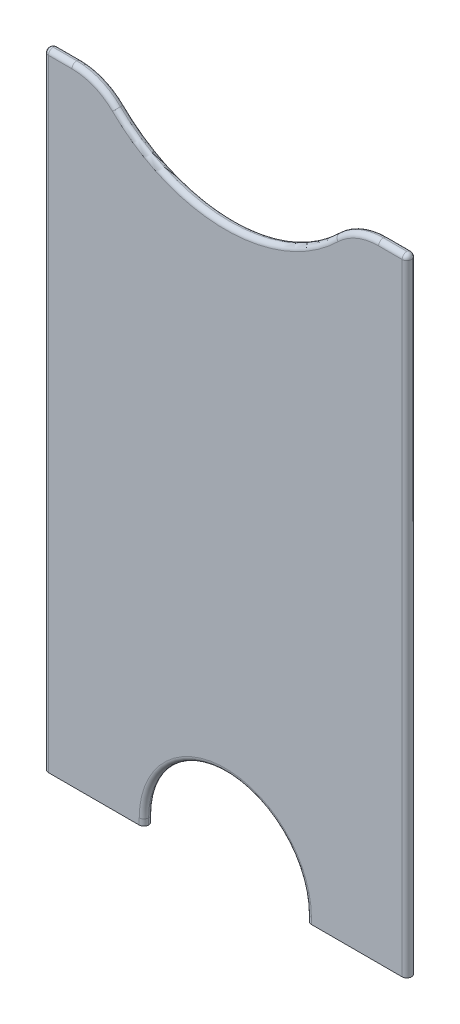
from build123d import *

# Parameters (mm, degrees)
BOSS_EXTRUDE1_DEPTH     = 100
CUT_EXTRUDE1_DEPTH      = 105.130927202
CUT_EXTRUDE1_DEPTH_BACK = 105.130927202
CUT_EXTRUDE2_DEPTH      = 10
FILLET6_R               = 10
FILLET7_R               = 10
FILLET13_R              = 0.75
FILLET14_R              = 0.75


with BuildPart() as part:
    # Sketch1 → Boss-Extrude1 (new body)
    with BuildSketch(Plane(origin=(0, 0, 0), x_dir=(1, 0, 0), z_dir=(0, 1, 0))):
        with BuildLine():
            Line((-28.25, 0), (28.25, 0))
            ThreePointArc((28.25, 0), (29, 0.75), (28.25, 1.5))
            Line((28.25, 1.5), (-28.25, 1.5))
            ThreePointArc((-28.25, 1.5), (-29, 0.75), (-28.25, 0))
        make_face()
    extrude(amount=BOSS_EXTRUDE1_DEPTH)

    # Sketch2 → Cut-Extrude1 (cut, two sides: drawn at the far end of the back side and taken through both)
    with BuildSketch(Plane.XY.offset(-CUT_EXTRUDE1_DEPTH_BACK)):
        with BuildLine():
            Line((-20, 100), (20, 100))
            ThreePointArc((20, 100), (0, 90), (-20, 100))
        make_face()
    extrude(amount=CUT_EXTRUDE1_DEPTH + CUT_EXTRUDE1_DEPTH_BACK, mode=Mode.SUBTRACT)

    # Sketch3 → Cut-Extrude2 (cut)
    with BuildSketch(Plane.XY):
        with BuildLine():
            Line((13, 1), (13, 0))
            Line((13, 0), (-13, 0))
            Line((-13, 0), (-13, 1))
            ThreePointArc((-13, 1), (0, 14), (13, 1))
        make_face()
    extrude(amount=-CUT_EXTRUDE2_DEPTH, mode=Mode.SUBTRACT)

    # Fillet6
    fillet6_edges = [part.edges().sort_by_distance(p)[0] for p in [
        (-20, 100, -0.75),
    ]]
    fillet(fillet6_edges, radius=FILLET6_R)

    # Fillet7
    fillet7_edges = [part.edges().sort_by_distance(p)[0] for p in [
        (20, 100, -0.75),
    ]]
    fillet(fillet7_edges, radius=FILLET7_R)

    # Fillet13
    fillet13_edges = [part.edges().sort_by_distance(p)[0] for p in [
        (20.715252698, 99.258200998, 0),
        (-20.715252698, 99.258200998, 0),
        (20.715252698, 99.258200998, -1.5),
        (-20.715252698, 99.258200998, -1.5),
        (29, 100, -0.75),
        (26.372448714, 100, 0),
        (26.372448714, 100, -1.5),
        (0, 90, -1.5),
        (0, 90, 0),
        (-29, 100, -0.75),
        (-26.372448714, 100, -1.5),
        (-26.372448714, 100, 0),
    ]]
    fillet(fillet13_edges, radius=FILLET13_R - 0.0001)  # a hair under: the kernel refuses the full size

    # Fillet14
    fillet14_edges = [part.edges().sort_by_distance(p)[0] for p in [
        (13, 0.5, -1.5),
        (-13, 0.5, -1.5),
        (13, 0.5, 0),
        (-13, 0.5, 0),
        (0, 14, -1.5),
        (0, 14, 0),
    ]]
    fillet(fillet14_edges, radius=FILLET14_R - 0.0001)  # a hair under: the kernel refuses the full size


solid = part.part
